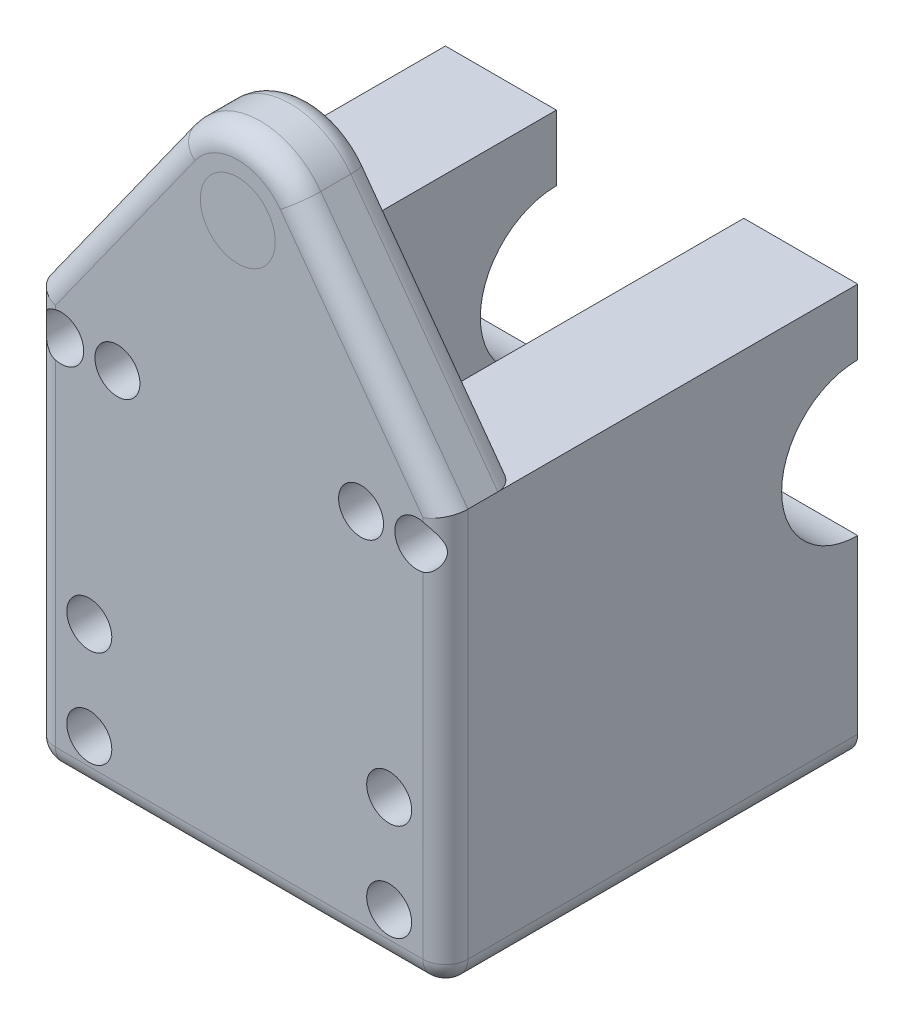
from build123d import *

# Parameters (mm, degrees)
SKETCH1_W             = 55
SKETCH1_H             = 14.803685478
BOSS_EXTRUDE1_DEPTH   = 45
SKETCH1_H_2           = 15.196314522
BOSS_EXTRUDE1_2_DEPTH = 45
SKETCH2_W             = 55
SKETCH2_H             = 55
BOSS_EXTRUDE2_DEPTH   = 10
SKETCH3_R             = 5
BOSS_EXTRUDE3_DEPTH   = 10
SKETCH4_R             = 5
BOSS_EXTRUDE4_DEPTH   = 3
SKETCH5_R             = 10.15
CUT_EXTRUDE1_DEPTH    = 51.5
SKETCH8_R             = 1.75
CUT_EXTRUDE3_DEPTH    = 85.937246471
SKETCH9_R             = 3
CUT_EXTRUDE4_DEPTH    = 40
FILLET2_R             = 3


with BuildPart() as part:
    # Sketch1 → Boss-Extrude1 (new body)
    with BuildSketch(Plane(origin=(0, 0, 0), x_dir=(0, 1, 0), z_dir=(0, 0, 1))):
        with Locations((0, 19.901842739)):
            Rectangle(SKETCH1_W, SKETCH1_H)
    extrude(amount=BOSS_EXTRUDE1_DEPTH)



with BuildPart() as body_2:
    # Sketch1 → Boss-Extrude1 2 (new body)
    with BuildSketch(Plane(origin=(0, 0, 0), x_dir=(0, 1, 0), z_dir=(0, 0, 1))):
        with Locations((0, -20.098157261)):
            Rectangle(SKETCH1_W, SKETCH1_H_2)
    extrude(amount=BOSS_EXTRUDE1_2_DEPTH)


with BuildPart() as part_1:
    add(part.part)

    add(body_2.part)  # Boss-Extrude2 merges body 2
    # Sketch2 → Boss-Extrude2 (add)
    with BuildSketch(Plane.XY.offset(45)):
        with Locations((0.196314522, 0)):
            Rectangle(SKETCH2_W, SKETCH2_H)
    extrude(amount=BOSS_EXTRUDE2_DEPTH)

    # Sketch3 → Boss-Extrude3 (add)
    with BuildSketch(Plane.XY.offset(55)):
        with BuildLine():
            ThreePointArc((8.078975052, 54.393230193), (-0.04804719, 58.499884573), (-8.135232017, 54.315324585))
            Line((-8.135232017, 54.315324585), (-27.303685478, 27.5))
            Line((-27.303685478, 27.5), (27.696314522, 27.5))
            Line((27.696314522, 27.5), (8.078975052, 54.393230193))
        make_face()
        with Locations((0, 48.5)):
            Circle(SKETCH3_R, mode=Mode.SUBTRACT)
    extrude(amount=-BOSS_EXTRUDE3_DEPTH)

    # Sketch5 → Cut-Extrude1 (cut)
    with BuildSketch(Plane.YZ.offset(27.696314522)):
        with Locations((8.6, 0)):
            Circle(SKETCH5_R)
    extrude(amount=-CUT_EXTRUDE1_DEPTH, mode=Mode.SUBTRACT)

    # Sketch8 → Cut-Extrude3 (cut, through all)
    with BuildSketch(Plane(origin=(0, 0, 0), x_dir=(1, 0, 0), z_dir=(0, 0, -1))):
        with Locations(Location((20.196314522, 21.0125, 0), (0, 0, 180))):
            Circle(SKETCH8_R)
        with Locations(Location((20.196314522, 8.0375, 0), (0, 0, 180))):
            Circle(SKETCH8_R)
        with Locations(Location((23.946314522, -23.125, 0), (0, 0, 180))):
            Circle(SKETCH8_R)
        with Locations(Location((16.446314522, -23.125, 0), (0, 0, 180))):
            Circle(SKETCH8_R)
        with Locations(Location((-16.053685478, -23.125, 0), (0, 0, 180))):
            Circle(SKETCH8_R)
        with Locations(Location((-23.553685478, -23.125, 0), (0, 0, 180))):
            Circle(SKETCH8_R)
        with Locations(Location((-19.803685478, 8.0375, 0), (0, 0, 180))):
            Circle(SKETCH8_R)
        with Locations(Location((-19.803685478, 21.0125, 0), (0, 0, 180))):
            Circle(SKETCH8_R)
    extrude(amount=-CUT_EXTRUDE3_DEPTH, mode=Mode.SUBTRACT)

    # Sketch9 → Cut-Extrude4 (cut)
    with BuildSketch(Plane.XY.offset(55)):
        with Locations((23.946314522, 23.125)):
            Circle(SKETCH9_R)
        with Locations((16.446314522, 23.125)):
            Circle(SKETCH9_R)
        with Locations((20.196314522, -8.0375)):
            Circle(SKETCH9_R)
        with Locations((20.196314522, -21.0125)):
            Circle(SKETCH9_R)
        with Locations((-16.053685478, 23.125)):
            Circle(SKETCH9_R)
        with Locations((-23.553685478, 23.125)):
            Circle(SKETCH9_R)
        with Locations((-19.803685478, -8.0375)):
            Circle(SKETCH9_R)
        with Locations((-19.803685478, -21.0125)):
            Circle(SKETCH9_R)
    extrude(amount=-CUT_EXTRUDE4_DEPTH, mode=Mode.SUBTRACT)

    # Fillet2
    # the kernel refuses this fillet: 3 mm, written as the material it takes off along each edge
    with BuildSketch(Plane(origin=(24.696314522, -24.5, 52), x_dir=(1, 0, 0), z_dir=(0, 0, 1))) as fillet2_piece_1_section:
        Polygon((0, 0), (FILLET2_R * 1.02, 0), (FILLET2_R * 1.02, -FILLET2_R * 1.02), (0, -FILLET2_R * 1.02), align=None)
    fillet2_piece_1 = extrude(amount=FILLET2_R * 1.02, mode=Mode.PRIVATE)
    fillet2_piece_1 = fillet2_piece_1 - Plane(origin=(24.696314522, -24.5, 52), x_dir=(-0.7071067811865477, 0.7071067811865475, 0), z_dir=(0, 0, 1)) * Sphere(FILLET2_R, mode=Mode.PRIVATE)
    add(fillet2_piece_1, mode=Mode.SUBTRACT)
    with BuildSketch(Plane(origin=(-24.303685478, -24.5, 52), x_dir=(0, -1, 0), z_dir=(0, 0, 1))) as fillet2_piece_2_section:
        Polygon((0, 0), (FILLET2_R * 1.02, 0), (FILLET2_R * 1.02, -FILLET2_R * 1.02), (0, -FILLET2_R * 1.02), align=None)
    fillet2_piece_2 = extrude(amount=FILLET2_R * 1.02, mode=Mode.PRIVATE)
    fillet2_piece_2 = fillet2_piece_2 - Plane(origin=(-24.303685478, -24.5, 52), x_dir=(0.7071067811865475, 0.7071067811865476, 0), z_dir=(0, 0, 1)) * Sphere(FILLET2_R, mode=Mode.PRIVATE)
    add(fillet2_piece_2, mode=Mode.SUBTRACT)
    with BuildSketch(Plane(origin=(27.696314522, -27.5, 0), x_dir=(-1, 0, 0), z_dir=(0, 0, 1)), Plane(origin=(-27.303685478, -27.5, 52), x_dir=(1, 0, 0), z_dir=(0, 0, -1))) as fillet2_piece_3:
        with BuildLine():
            CenterArc((FILLET2_R, -FILLET2_R), FILLET2_R, 90, 90)
            Line((0, -FILLET2_R), (-FILLET2_R * 0.02, -FILLET2_R))
            Line((-FILLET2_R * 0.02, -FILLET2_R), (-FILLET2_R * 0.02, FILLET2_R * 0.02))
            Line((-FILLET2_R * 0.02, FILLET2_R * 0.02), (FILLET2_R, FILLET2_R * 0.02))
            Line((FILLET2_R, FILLET2_R * 0.02), (FILLET2_R, 0))
        make_face()
    extrude(amount=52, mode=Mode.SUBTRACT)
    with BuildSketch(Plane(origin=(-27.303685478, -24.5, 55), x_dir=(0, 0, -1), z_dir=(0, 1, 0))) as fillet2_piece_4_section:
        with BuildLine():
            CenterArc((FILLET2_R, -FILLET2_R), FILLET2_R, 90, 90)
            Line((0, -FILLET2_R), (-FILLET2_R * 0.02, -FILLET2_R))
            Line((-FILLET2_R * 0.02, -FILLET2_R), (-FILLET2_R * 0.02, FILLET2_R * 0.02))
            Line((-FILLET2_R * 0.02, FILLET2_R * 0.02), (FILLET2_R, FILLET2_R * 0.02))
            Line((FILLET2_R, FILLET2_R * 0.02), (FILLET2_R, 0))
        make_face()
    fillet2_piece_4 = extrude(amount=59.5, mode=Mode.PRIVATE)
    fillet2_piece_4 = split(fillet2_piece_4, bisect_by=Plane(origin=(-39.142199002, 10.938748286, 54.327343255), z_dir=(0.8135232017068688, -0.5815324584961749, 0)), keep=Keep.TOP, mode=Mode.PRIVATE)
    add(fillet2_piece_4, mode=Mode.SUBTRACT)
    with BuildSketch(Plane(origin=(24.696314522, -27.5, 55), x_dir=(0, 0, -1), z_dir=(-1, 0, 0))) as fillet2_piece_5:
        with BuildLine():
            CenterArc((FILLET2_R, -FILLET2_R), FILLET2_R, 90, 90)
            Line((0, -FILLET2_R), (-FILLET2_R * 0.02, -FILLET2_R))
            Line((-FILLET2_R * 0.02, -FILLET2_R), (-FILLET2_R * 0.02, FILLET2_R * 0.02))
            Line((-FILLET2_R * 0.02, FILLET2_R * 0.02), (FILLET2_R, FILLET2_R * 0.02))
            Line((FILLET2_R, FILLET2_R * 0.02), (FILLET2_R, 0))
        make_face()
    extrude(amount=49, mode=Mode.SUBTRACT)
    with BuildSketch(Plane(origin=(27.696314522, 35, 55), x_dir=(-1, 0, 0), z_dir=(0, -1, 0))) as fillet2_piece_6_section:
        with BuildLine():
            CenterArc((FILLET2_R, FILLET2_R), FILLET2_R, 180, 90)
            Line((0, FILLET2_R), (-FILLET2_R * 0.02, FILLET2_R))
            Line((-FILLET2_R * 0.02, FILLET2_R), (-FILLET2_R * 0.02, -FILLET2_R * 0.02))
            Line((-FILLET2_R * 0.02, -FILLET2_R * 0.02), (FILLET2_R, -FILLET2_R * 0.02))
            Line((FILLET2_R, -FILLET2_R * 0.02), (FILLET2_R, 0))
        make_face()
    fillet2_piece_6 = extrude(amount=59.5, mode=Mode.PRIVATE)
    fillet2_piece_6 = split(fillet2_piece_6, bisect_by=Plane(origin=(39.610410285, 11.167075732, 54.327214702), z_dir=(-0.8078975051993711, -0.5893230193133748, 0)), keep=Keep.TOP, mode=Mode.PRIVATE)
    add(fillet2_piece_6, mode=Mode.SUBTRACT)
    with BuildSketch(Plane(origin=(32.116237167, 21.440768711, 45), x_dir=(-0.807897505199371, -0.5893230193133747, 0), z_dir=(-0.5893230193133748, 0.8078975051993711, 0))) as fillet2_piece_7_section:
        with BuildLine():
            CenterArc((FILLET2_R, FILLET2_R), FILLET2_R, 180, 90)
            Line((0, FILLET2_R), (-FILLET2_R * 0.02, FILLET2_R))
            Line((-FILLET2_R * 0.02, FILLET2_R), (-FILLET2_R * 0.02, -FILLET2_R * 0.02))
            Line((-FILLET2_R * 0.02, -FILLET2_R * 0.02), (FILLET2_R, -FILLET2_R * 0.02))
            Line((FILLET2_R, -FILLET2_R * 0.02), (FILLET2_R, 0))
        make_face()
    fillet2_piece_7 = extrude(amount=40.787923307, mode=Mode.PRIVATE)
    fillet2_piece_7 = split(fillet2_piece_7, bisect_by=Plane(origin=(17.200847448, 27.5, 45.684561455), z_dir=(0, 1, 0)), keep=Keep.TOP, mode=Mode.PRIVATE)
    fillet2_piece_7 = split(fillet2_piece_7, bisect_by=Plane(origin=(27.696314522, 40.751258777, 45.684561455), z_dir=(-1, 0, 0)), keep=Keep.TOP, mode=Mode.PRIVATE)
    add(fillet2_piece_7, mode=Mode.SUBTRACT)
    with BuildSketch(Plane(origin=(-8.135232017, 54.315324585, 55), x_dir=(0, 0, -1), z_dir=(-0.5815324584961749, -0.8135232017068688, 0))) as fillet2_piece_8_section:
        with BuildLine():
            CenterArc((FILLET2_R, FILLET2_R), FILLET2_R, 180, 90)
            Line((0, FILLET2_R), (-FILLET2_R * 0.02, FILLET2_R))
            Line((-FILLET2_R * 0.02, FILLET2_R), (-FILLET2_R * 0.02, -FILLET2_R * 0.02))
            Line((-FILLET2_R * 0.02, -FILLET2_R * 0.02), (FILLET2_R, -FILLET2_R * 0.02))
            Line((FILLET2_R, -FILLET2_R * 0.02), (FILLET2_R, 0))
        make_face()
    fillet2_piece_8 = extrude(amount=40.461966578, mode=Mode.PRIVATE)
    fillet2_piece_8 = split(fillet2_piece_8, bisect_by=Plane(origin=(-27.303685478, 40.106363317, 54.331008368), z_dir=(1, 0, 0)), keep=Keep.TOP, mode=Mode.PRIVATE)
    add(fillet2_piece_8, mode=Mode.SUBTRACT)
    with BuildSketch(Plane(origin=(0, 48.5, 45), x_dir=(0.8078975051993723, 0.589323019313373, 0), z_dir=(0.589323019313373, -0.8078975051993723, 0))) as fillet2_piece_9:
        with BuildLine():
            CenterArc((10 - FILLET2_R, FILLET2_R), FILLET2_R, 270, 90)
            Line((10, FILLET2_R), (10 + FILLET2_R * 0.02, FILLET2_R))
            Line((10 + FILLET2_R * 0.02, FILLET2_R), (10 + FILLET2_R * 0.02, -FILLET2_R * 0.02))
            Line((10 + FILLET2_R * 0.02, -FILLET2_R * 0.02), (10 - FILLET2_R, -FILLET2_R * 0.02))
            Line((10 - FILLET2_R, -FILLET2_R * 0.02), (10 - FILLET2_R, 0))
        make_face()
    revolve(axis=Axis((0, 48.5, 45), (0, 0, 1)), revolution_arc=108.332617753, mode=Mode.SUBTRACT)
    with BuildSketch(Plane(origin=(-8.135232017, 54.315324585, 45), x_dir=(0.8135232017068688, -0.5815324584961749, 0), z_dir=(-0.5815324584961749, -0.8135232017068688, 0))) as fillet2_piece_10_section:
        with BuildLine():
            CenterArc((FILLET2_R, FILLET2_R), FILLET2_R, 180, 90)
            Line((0, FILLET2_R), (-FILLET2_R * 0.02, FILLET2_R))
            Line((-FILLET2_R * 0.02, FILLET2_R), (-FILLET2_R * 0.02, -FILLET2_R * 0.02))
            Line((-FILLET2_R * 0.02, -FILLET2_R * 0.02), (FILLET2_R, -FILLET2_R * 0.02))
            Line((FILLET2_R, -FILLET2_R * 0.02), (FILLET2_R, 0))
        make_face()
    fillet2_piece_10 = extrude(amount=40.461966578, mode=Mode.PRIVATE)
    fillet2_piece_10 = split(fillet2_piece_10, bisect_by=Plane(origin=(-17.033553268, 27.5, 45.684501735), z_dir=(0, 1, 0)), keep=Keep.TOP, mode=Mode.PRIVATE)
    fillet2_piece_10 = split(fillet2_piece_10, bisect_by=Plane(origin=(-27.303685478, 40.714914047, 45.684501735), z_dir=(1, 0, 0)), keep=Keep.TOP, mode=Mode.PRIVATE)
    add(fillet2_piece_10, mode=Mode.SUBTRACT)
    with BuildSketch(Plane(origin=(0, 48.5, 45), x_dir=(1, 0, 0), z_dir=(0, -1, 0))) as fillet2_piece_11:
        with BuildLine():
            CenterArc((5 + FILLET2_R, FILLET2_R), FILLET2_R, 180, 90)
            Line((5, FILLET2_R), (5 - FILLET2_R * 0.02, FILLET2_R))
            Line((5 - FILLET2_R * 0.02, FILLET2_R), (5 - FILLET2_R * 0.02, -FILLET2_R * 0.02))
            Line((5 - FILLET2_R * 0.02, -FILLET2_R * 0.02), (5 + FILLET2_R, -FILLET2_R * 0.02))
            Line((5 + FILLET2_R, -FILLET2_R * 0.02), (5 + FILLET2_R, 0))
        make_face()
    revolve(axis=Axis((0, 48.5, 45), (0, 0, 1)), mode=Mode.SUBTRACT)
    with BuildSketch(Plane(origin=(32.116237167, 21.440768711, 55), x_dir=(0, 0, -1), z_dir=(-0.5893230193133748, 0.8078975051993711, 0))) as fillet2_piece_12_section:
        with BuildLine():
            CenterArc((FILLET2_R, FILLET2_R), FILLET2_R, 180, 90)
            Line((0, FILLET2_R), (-FILLET2_R * 0.02, FILLET2_R))
            Line((-FILLET2_R * 0.02, FILLET2_R), (-FILLET2_R * 0.02, -FILLET2_R * 0.02))
            Line((-FILLET2_R * 0.02, -FILLET2_R * 0.02), (FILLET2_R, -FILLET2_R * 0.02))
            Line((FILLET2_R, -FILLET2_R * 0.02), (FILLET2_R, 0))
        make_face()
    fillet2_piece_12 = extrude(amount=40.787923307, mode=Mode.PRIVATE)
    fillet2_piece_12 = split(fillet2_piece_12, bisect_by=Plane(origin=(27.696314522, 40.151087801, 54.330714457), z_dir=(-1, 0, 0)), keep=Keep.TOP, mode=Mode.PRIVATE)
    add(fillet2_piece_12, mode=Mode.SUBTRACT)
    with BuildSketch(Plane(origin=(0, 48.5, 55), x_dir=(0.8078975051993723, 0.589323019313373, 0), z_dir=(0.589323019313373, -0.8078975051993723, 0))) as fillet2_piece_13:
        with BuildLine():
            CenterArc((10 - FILLET2_R, -FILLET2_R), FILLET2_R, 0, 90)
            Line((10 - FILLET2_R, 0), (10 - FILLET2_R, FILLET2_R * 0.02))
            Line((10 - FILLET2_R, FILLET2_R * 0.02), (10 + FILLET2_R * 0.02, FILLET2_R * 0.02))
            Line((10 + FILLET2_R * 0.02, FILLET2_R * 0.02), (10 + FILLET2_R * 0.02, -FILLET2_R))
            Line((10 + FILLET2_R * 0.02, -FILLET2_R), (10, -FILLET2_R))
        make_face()
    revolve(axis=Axis((0, 48.5, 55), (0, 0, 1)), revolution_arc=108.332617753, mode=Mode.SUBTRACT)
    with BuildSketch(Plane(origin=(-27.303685478, -24.5, 55), x_dir=(0, 0, -1), z_dir=(0, 1, 0))) as fillet2_piece_14a_section:
        with BuildLine():
            CenterArc((FILLET2_R, -FILLET2_R), FILLET2_R, 90, 90)
            Line((0, -FILLET2_R), (-FILLET2_R * 0.02, -FILLET2_R))
            Line((-FILLET2_R * 0.02, -FILLET2_R), (-FILLET2_R * 0.02, FILLET2_R * 0.02))
            Line((-FILLET2_R * 0.02, FILLET2_R * 0.02), (FILLET2_R, FILLET2_R * 0.02))
            Line((FILLET2_R, FILLET2_R * 0.02), (FILLET2_R, 0))
        make_face()
    fillet2_piece_14a = extrude(amount=59.5, mode=Mode.PRIVATE)
    fillet2_piece_14a = split(fillet2_piece_14a, bisect_by=Plane(origin=(-25.13493708, 30.533927195, 54.268036467), z_dir=(-0.8135232017068688, 0.5815324584961749, 0)), keep=Keep.TOP, mode=Mode.PRIVATE)
    with BuildSketch(Plane(origin=(-8.135232017, 54.315324585, 55), x_dir=(0, 0, -1), z_dir=(-0.5815324584961749, -0.8135232017068688, 0))) as fillet2_piece_14b_section:
        with BuildLine():
            CenterArc((FILLET2_R, FILLET2_R), FILLET2_R, 180, 90)
            Line((0, FILLET2_R), (-FILLET2_R * 0.02, FILLET2_R))
            Line((-FILLET2_R * 0.02, FILLET2_R), (-FILLET2_R * 0.02, -FILLET2_R * 0.02))
            Line((-FILLET2_R * 0.02, -FILLET2_R * 0.02), (FILLET2_R, -FILLET2_R * 0.02))
            Line((FILLET2_R, -FILLET2_R * 0.02), (FILLET2_R, 0))
        make_face()
    fillet2_piece_14b = extrude(amount=40.461966578, mode=Mode.PRIVATE)
    fillet2_piece_14b = split(fillet2_piece_14b, bisect_by=Plane(origin=(-27.303685478, 23.770632246, 54.268036467), z_dir=(-1, 0, 0)), keep=Keep.TOP, mode=Mode.PRIVATE)
    fillet2_piece_14 = fillet2_piece_14a & fillet2_piece_14b
    add(fillet2_piece_14, mode=Mode.SUBTRACT)
    with BuildSketch(Plane(origin=(32.116237167, 21.440768711, 55), x_dir=(0, 0, -1), z_dir=(-0.5893230193133748, 0.8078975051993711, 0))) as fillet2_piece_15a_section:
        with BuildLine():
            CenterArc((FILLET2_R, FILLET2_R), FILLET2_R, 180, 90)
            Line((0, FILLET2_R), (-FILLET2_R * 0.02, FILLET2_R))
            Line((-FILLET2_R * 0.02, FILLET2_R), (-FILLET2_R * 0.02, -FILLET2_R * 0.02))
            Line((-FILLET2_R * 0.02, -FILLET2_R * 0.02), (FILLET2_R, -FILLET2_R * 0.02))
            Line((FILLET2_R, -FILLET2_R * 0.02), (FILLET2_R, 0))
        make_face()
    fillet2_piece_15a = extrude(amount=40.787923307, mode=Mode.PRIVATE)
    fillet2_piece_15a = split(fillet2_piece_15a, bisect_by=Plane(origin=(27.696314522, 23.793798238, 54.269244258), z_dir=(1, 0, 0)), keep=Keep.TOP, mode=Mode.PRIVATE)
    with BuildSketch(Plane(origin=(27.696314522, 35, 55), x_dir=(-1, 0, 0), z_dir=(0, -1, 0))) as fillet2_piece_15b_section:
        with BuildLine():
            CenterArc((FILLET2_R, FILLET2_R), FILLET2_R, 180, 90)
            Line((0, FILLET2_R), (-FILLET2_R * 0.02, FILLET2_R))
            Line((-FILLET2_R * 0.02, FILLET2_R), (-FILLET2_R * 0.02, -FILLET2_R * 0.02))
            Line((-FILLET2_R * 0.02, -FILLET2_R * 0.02), (FILLET2_R, -FILLET2_R * 0.02))
            Line((FILLET2_R, -FILLET2_R * 0.02), (FILLET2_R, 0))
        make_face()
    fillet2_piece_15b = extrude(amount=59.5, mode=Mode.PRIVATE)
    fillet2_piece_15b = split(fillet2_piece_15b, bisect_by=Plane(origin=(25.512164509, 30.494231157, 54.269244258), z_dir=(0.8078975051993711, 0.5893230193133748, 0)), keep=Keep.TOP, mode=Mode.PRIVATE)
    fillet2_piece_15 = fillet2_piece_15a & fillet2_piece_15b
    add(fillet2_piece_15, mode=Mode.SUBTRACT)


with BuildPart() as body_2_2:
    # Sketch4 → Boss-Extrude4 (new body)
    with BuildSketch(Plane.XY.offset(55)):
        with Locations((0, 48.5)):
            Circle(SKETCH4_R)
    extrude(amount=-BOSS_EXTRUDE4_DEPTH)


solid = Compound([part_1.part, body_2_2.part])
